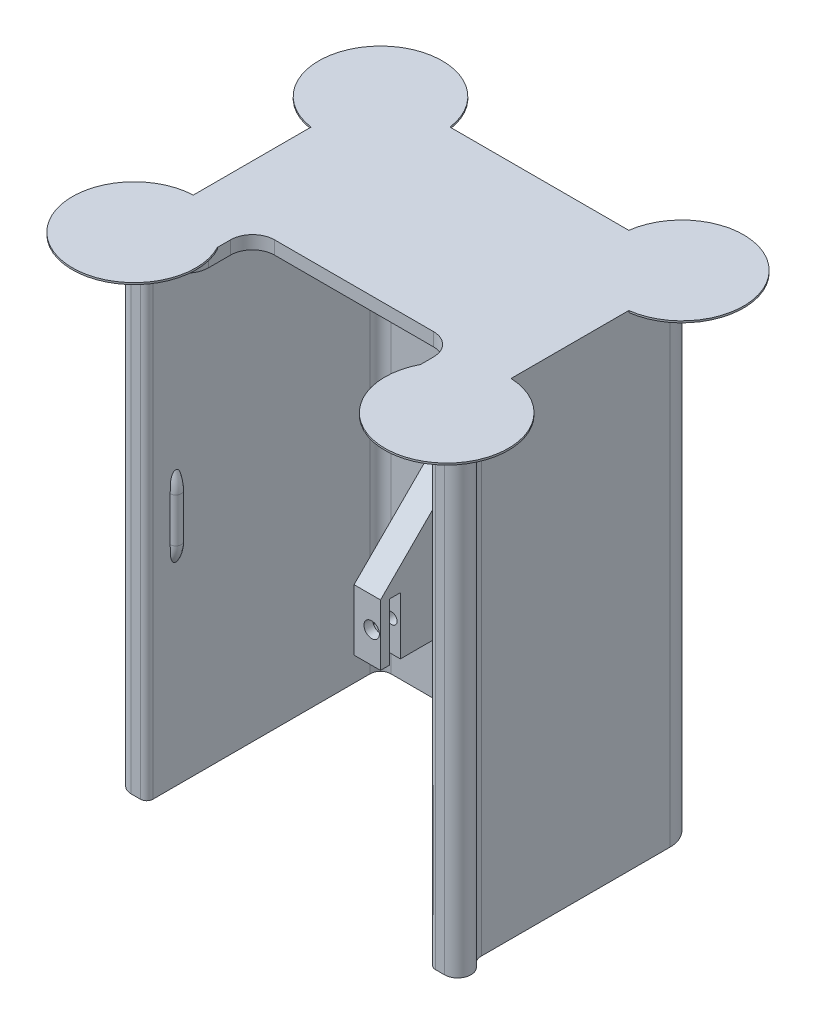
from build123d import *

# Parameters (mm, degrees)
BOSS_EXTRUDE1_START              = -53
BOSS_EXTRUDE1_DEPTH              = 110
SKETCH4_R                        = 1.25
BOSS_EXTRUDE4_START              = -3
BOSS_EXTRUDE4_DEPTH              = 3
MIRROR5_COPY_1_SKETCH_R          = 1.25
SKETCH7_R                        = 1.5
BOSS_EXTRUDE5_DEPTH              = 6
BOSS_EXTRUDE8_DEPTH              = 4
SKETCH16_W                       = 8
SKETCH16_H                       = 4.387482586
BOSS_EXTRUDE9_DEPTH              = 2
LPATTERN1_COUNT                  = 2
LPATTERN1_PITCH                  = 35.3
BOSS_EXTRUDE6_DEPTH              = 6
M2_5_START                       = -34.5
M2_5_CLEARANCE_HOLE1_OUTLINE_R   = 1.75
M2_5_CLEARANCE_HOLE1_OUTLINE_R_2 = 1.25
M2_5_CLEARANCE_HOLE1_DEPTH       = 2
CUT_EXTRUDE1_REACH               = 91.332
CHAMFER1_SIZE                    = 1
CHAMFER1_SIZE2                   = 0.577350269
SKETCH14_R                       = 14
BOSS_EXTRUDE7_DEPTH              = 0.4
SKETCH17_W                       = 6
SKETCH17_H                       = 6
BOSS_EXTRUDE10_DEPTH             = 3


# Read off the part's stored shape, not the designer's step: M2.5 Clearance Hole1
with BuildPart() as part:
    # Sketch1 → Boss-Extrude1 (new body)
    with BuildSketch(Plane(origin=(0, 0, 0), x_dir=(1, 0, 0), z_dir=(0, 1, 0)).offset(BOSS_EXTRUDE1_START)):
        with BuildLine():
            Line((0, 53), (29.656980225, 53))
            ThreePointArc((29.656980225, 53), (31.313745396, 52.313745396), (32, 50.656980225))
            Line((32, 50.656980225), (32, 1.419566892))
            ThreePointArc((32, 1.419566892), (32.415781516, 0.415781516), (33.419566892, 0))
            Line((33.419566892, 0), (35.5, 0))
            ThreePointArc((35.5, 0), (38.355704445, 2.080787228), (37.25, 5.436698586))
            ThreePointArc((37.25, 5.436698586), (36.330730437, 6.504090779), (36, 7.873397172))
            Line((36, 7.873397172), (36, 50.656980225))
            ThreePointArc((36, 50.656980225), (34.142172521, 55.142172521), (29.656980225, 57))
            Line((29.656980225, 57), (0, 57))
            Line((0, 57), (0, 53))
        make_face()
    boss_extrude1 = extrude(amount=BOSS_EXTRUDE1_DEPTH)

    # Sweep1: sweep along a path in Sketch3
    with BuildLine(Plane.XY.offset(-6.6)) as sweep1_path:
        Line((32, 0), (32, 5))
        ThreePointArc((32, 5), (32.438860523, 7.252493666), (33.691242572, 9.17547715))
    # Sketch4 → Sweep1 (sweep)
    with BuildSketch(Plane(origin=(0, 0, 0), x_dir=(1, 0, 0), z_dir=(0, 1, 0))):
        with Locations((32, 6.6)):
            Circle(SKETCH4_R)
    sweep1 = sweep(path=sweep1_path.line)

    # Mirror1: Sweep1 across plane
    add(sweep1.mirror(Plane.ZX))

    # Sketch6 → Boss-Extrude4 (add)
    with BuildSketch(Plane(origin=(0, 57, 0), x_dir=(1, 0, 0), z_dir=(0, 1, 0)).offset(BOSS_EXTRUDE4_START)):
        with BuildLine():
            Line((35.5, 0), (28, 0))
            ThreePointArc((28, 0), (24.464466094, 1.464466094), (23, 5))
            Line((23, 5), (23, 10))
            ThreePointArc((23, 10), (21.535533906, 13.535533906), (18, 15))
            Line((18, 15), (0, 15))
            Line((0, 15), (0, 57))
            Line((0, 57), (29.656980225, 57))
            ThreePointArc((29.656980225, 57), (34.142172521, 55.142172521), (36, 50.656980225))
            Line((36, 50.656980225), (36, 7.873397172))
            ThreePointArc((36, 7.873397172), (36.330730437, 6.504090779), (37.25, 5.436698586))
            ThreePointArc((37.25, 5.436698586), (38.355704445, 2.080787228), (35.5, 0))
        make_face()
    boss_extrude4 = extrude(amount=BOSS_EXTRUDE4_DEPTH)

    # Mirror5: Boss-Extrude1, Sweep1, Boss-Extrude4 across plane
    add(boss_extrude1.mirror(Plane(origin=(0, 0, 0), x_dir=(0, 0, 1), z_dir=(1, 0, 0))))
    add(sweep1.mirror(Plane(origin=(0, 0, 0), x_dir=(0, 0, 1), z_dir=(1, 0, 0))))
    add(boss_extrude4.mirror(Plane(origin=(0, 0, 0), x_dir=(0, 0, 1), z_dir=(1, 0, 0))))

    # Mirror5 copy 1: sweep along a path in Mirror5 copy 1 path
    with BuildLine(Plane(origin=(0, 0, -6.6), x_dir=(-1, 0, 0), z_dir=(0, 0, 1))) as mirror5_copy_1_path:
        Line((32, 0), (32, 5))
        ThreePointArc((32, 5), (32.438860523, 7.252493666), (33.691242572, 9.17547715))
    # Mirror5 copy 1 sketch → Mirror5 copy 1 (sweep)
    with BuildSketch(Plane(origin=(0, 0, 0), x_dir=(-1, 0, 0), z_dir=(0, -1, 0))):
        with Locations((32, 6.6)):
            Circle(MIRROR5_COPY_1_SKETCH_R)
    sweep(path=mirror5_copy_1_path.line)

    # Sketch7 → Boss-Extrude5 (add)
    with BuildSketch(Plane.XY.offset(-37)):
        with BuildLine():
            Line((-22, 54), (-30, 54))
            Line((-30, 54), (-30, 48))
            ThreePointArc((-30, 48), (-26, 44), (-22, 48))
            Line((-22, 48), (-22, 54))
        make_face()
        with Locations((-26, 48)):
            Circle(SKETCH7_R, mode=Mode.SUBTRACT)
    boss_extrude5 = extrude(amount=-BOSS_EXTRUDE5_DEPTH)

    # Sketch15 → Boss-Extrude8 (add)
    with BuildSketch(Plane(origin=(0, 0, -43), x_dir=(-1, 0, 0), z_dir=(0, 0, -1))):
        with BuildLine():
            Line((22, 54), (30, 54))
            Line((30, 54), (30, 48))
            ThreePointArc((30, 48), (29.90014135, 47.111801008), (29.605551275, 46.267949192))
            Line((29.605551275, 46.267949192), (29, 46.267949192))
            Line((29, 46.267949192), (29, 49.732050808))
            Line((29, 49.732050808), (26, 51.464101615))
            Line((26, 51.464101615), (23, 49.732050808))
            Line((23, 49.732050808), (23, 46.267949192))
            Line((23, 46.267949192), (22.394448725, 46.267949192))
            ThreePointArc((22.394448725, 46.267949192), (22.09985865, 47.111801008), (22, 48))
            Line((22, 48), (22, 54))
        make_face()
    boss_extrude8 = extrude(amount=BOSS_EXTRUDE8_DEPTH)

    # Sketch16 → Boss-Extrude9 (add)
    with BuildSketch(Plane(origin=(0, 0, -47), x_dir=(-1, 0, 0), z_dir=(0, 0, -1))):
        with Locations((26, 51.806258707)):
            Rectangle(SKETCH16_W, SKETCH16_H)
    boss_extrude9 = extrude(amount=BOSS_EXTRUDE9_DEPTH)

    # LPattern1: Boss-Extrude5, Boss-Extrude8, Boss-Extrude9 ×2
    with Locations(*[(i * LPATTERN1_PITCH, 0, 0) for i in range(1, LPATTERN1_COUNT)]):
        add(boss_extrude5)
        add(boss_extrude8)
        add(boss_extrude9)

    # Sketch8 → Boss-Extrude6 (add)
    with BuildSketch(Plane(origin=(11.5, 0, 0), x_dir=(0, 0, -1), z_dir=(1, 0, 0))):
        Polygon((53, 1.328427125), (53, -33), (51, -33), (51, -14.490491737), (45, -14.490491737), (45, -33), (37, -33), (37, -20), (34.5, -20), (34.5, -33), (32.5, -33), (32.5, -19.171572875), align=None)
    boss_extrude6 = extrude(amount=BOSS_EXTRUDE6_DEPTH)

    # Sketch9 → Tap Drill for M2.5 Tap1 (revolve, cut)
    with BuildSketch(Plane(origin=(13.5, -26, -32.5), x_dir=(0, -1, 0), z_dir=(1, 0, 0))):
        Polygon((0, 0), (0, 10.751075774), (1.25, 10), (1.25, 0), align=None)
    tap_drill_for_m2_5_tap1 = revolve(axis=Axis((13.5, -26, -26.15), (0, 0, -1)), mode=Mode.SUBTRACT)

    # M2.5 Clearance Hole1 outline → M2.5 Clearance Hole1 (cut)
    with BuildSketch(Plane.XY.offset(M2_5_START)):
        with Locations((13.5, -26)):
            Circle(M2_5_CLEARANCE_HOLE1_OUTLINE_R)
        with Locations((13.5, -26)):
            Circle(M2_5_CLEARANCE_HOLE1_OUTLINE_R_2, mode=Mode.SUBTRACT)
    m2_5_clearance_hole1 = extrude(amount=M2_5_CLEARANCE_HOLE1_DEPTH, mode=Mode.SUBTRACT)

    # Mirror6: Boss-Extrude6, Tap Drill for M2.5 Tap1, M2.5 Clearance Hole1 across plane
    add(boss_extrude6.mirror(Plane(origin=(0, 0, 0), x_dir=(0, 0, 1), z_dir=(1, 0, 0))))
    add(tap_drill_for_m2_5_tap1.mirror(Plane(origin=(0, 0, 0), x_dir=(0, 0, 1), z_dir=(1, 0, 0))), mode=Mode.SUBTRACT)
    add(m2_5_clearance_hole1.mirror(Plane(origin=(0, 0, 0), x_dir=(0, 0, 1), z_dir=(1, 0, 0))), mode=Mode.SUBTRACT)

    # Sketch13 → Cut-Extrude1 (cut, up to next)
    with BuildSketch(Plane(origin=(0, 0, -57), x_dir=(-1, 0, 0), z_dir=(0, 0, -1)), mode=Mode.PRIVATE) as cut_extrude1_sk1:
        with BuildLine():
            Line((0, 46.767640687), (2.121320344, 44.646320344))
            ThreePointArc((2.121320344, 44.646320344), (3, 42.525), (2.121320344, 40.403679656))
            Line((2.121320344, 40.403679656), (0, 38.282359313))
            Line((0, 38.282359313), (-2.121320344, 40.403679656))
            ThreePointArc((-2.121320344, 40.403679656), (-3, 42.525), (-2.121320344, 44.646320344))
            Line((-2.121320344, 44.646320344), (0, 46.767640687))
        make_face()
    cut_extrude1_tool1 = extrude(cut_extrude1_sk1.sketch, amount=-CUT_EXTRUDE1_REACH, mode=Mode.PRIVATE) & part.part
    add(cut_extrude1_tool1.solids().sort_by_distance((0, 42.525, -57))[0], mode=Mode.SUBTRACT)

    # Chamfer1
    chamfer1_edges = [part.edges().sort_by_distance(p)[0] for p in [
        (1.060660172, 45.706980515, -57),
        (3, 42.525, -57),
        (1.060660172, 39.343019485, -57),
        (-1.060660172, 39.343019485, -57),
        (-3, 42.525, -57),
        (-1.060660172, 45.706980515, -57),
    ]]
    chamfer1_side = [part.faces().sort_by_distance(p)[0] for p in [
        (0, 1.799402533, -57),
    ]]
    chamfer(chamfer1_edges, length=CHAMFER1_SIZE, length2=CHAMFER1_SIZE2, reference=chamfer1_side[0])

    # Sketch14 → Boss-Extrude7 (add)
    with BuildSketch(Plane(origin=(0, 57, 0), x_dir=(1, 0, 0), z_dir=(0, 1, 0))):
        with Locations((-35.414213562, 0.585786438)):
            Circle(SKETCH14_R)
        with Locations((-34.142172521, 55.142172521)):
            Circle(SKETCH14_R)
        with Locations((34.142172521, 55.142172521)):
            Circle(SKETCH14_R)
        with Locations((35.414213562, 0.585786438)):
            Circle(SKETCH14_R)
    extrude(amount=-BOSS_EXTRUDE7_DEPTH)

    # Sketch17 → Boss-Extrude10 (add, symmetric)
    with BuildSketch(Plane.XY.offset(-37)):
        Polygon((32, 34.455654624), (19.439992088, 21.895646712), (19.439992088, 12.285308184), (32, 12.285308184), align=None)
        with Locations((25.439992088, 18.285308184)):
            Rectangle(SKETCH17_W, SKETCH17_H, mode=Mode.SUBTRACT)
    extrude(amount=BOSS_EXTRUDE10_DEPTH, both=True)


solid = part.part
